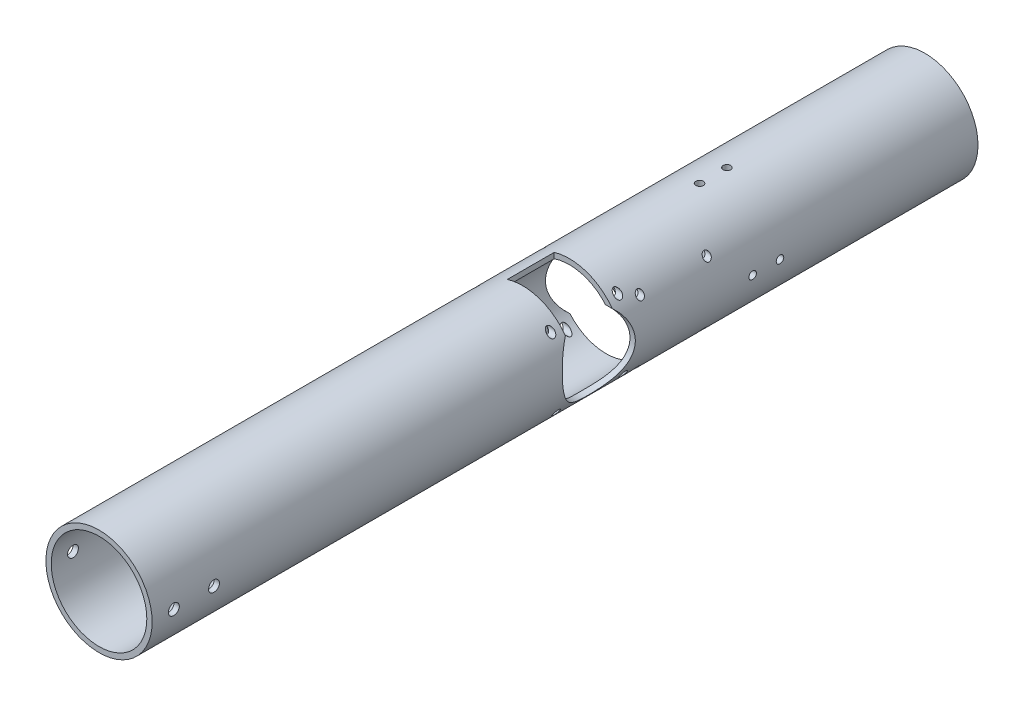
from build123d import *

# Parameters (mm, degrees)
BOSS_EXTRUDE1_DEPTH           = 125
BOSS_EXTRUDE1_DEPTH_BACK      = 250
SKETCH1_R                     = 31.75
SKETCH1_R_2                   = 28.575
SKETCH2_R                     = 21.75
CUT_EXTRUDE1_DEPTH            = 255.000246063
SKETCH3_R                     = 21.75
CUT_EXTRUDE2_DEPTH            = 255.000246187
CUT_EXTRUDE4_START            = 9
SKETCH5_W                     = 28
SKETCH5_H                     = 22
CUT_EXTRUDE4_DEPTH            = 264.000246187
CUT_EXTRUDE5_START            = -9
SKETCH6_W                     = 28
SKETCH6_H                     = 22
CUT_EXTRUDE5_DEPTH            = 264.000246187
CUT_EXTRUDE8_DEPTH            = 255.000246187
CUT_EXTRUDE8_DEPTH_BACK       = 255.000246187
SKETCH11_R                    = 2
CUT_EXTRUDE10_DEPTH           = 255.000246187
CUT_EXTRUDE10_DEPTH_BACK      = 255.000246187
SKETCH12_R                    = 3.25
CUT_EXTRUDE12_DEPTH           = 255.000246187
CUT_EXTRUDE12_DEPTH_BACK      = 255.000246187
SKETCH15_R                    = 2
SKETCH19_W                    = 2.25
SKETCH19_H                    = 31.75
M4_CLEARANCE_HOLE1_AT_2_COUNT = 2
M4_CLEARANCE_HOLE1_AT_2_PITCH = 40
M4_CLEARANCE_HOLE1_AT_3_COUNT = 2
M4_CLEARANCE_HOLE1_AT_3_PITCH = 40
M4_CLEARANCE_HOLE1_AT_4_COUNT = 2
M4_CLEARANCE_HOLE1_AT_4_PITCH = 56.568542495
M4_CLEARANCE_HOLE1_AT_5_COUNT = 2
M4_CLEARANCE_HOLE1_AT_5_PITCH = 90.126807577
M4_CLEARANCE_HOLE1_AT_6_COUNT = 2
M4_CLEARANCE_HOLE1_AT_6_PITCH = 50.197623888
M4_CLEARANCE_HOLE1_AT_7_COUNT = 2
M4_CLEARANCE_HOLE1_AT_7_PITCH = 100.213978286
M4_CLEARANCE_HOLE1_AT_8_COUNT = 2
M4_CLEARANCE_HOLE1_AT_8_PITCH = 66.631835064
MIRROR1_COPY_1_SKETCH_W       = 2.25
MIRROR1_COPY_1_SKETCH_H       = 31.75
MIRROR1_COPY_2_SKETCH_W       = 2.25
MIRROR1_COPY_2_SKETCH_H       = 31.75
MIRROR1_COPY_3_SKETCH_W       = 2.25
MIRROR1_COPY_3_SKETCH_H       = 31.75
MIRROR1_COPY_4_SKETCH_W       = 2.25
MIRROR1_COPY_4_SKETCH_H       = 31.75
MIRROR1_COPY_5_SKETCH_W       = 2.25
MIRROR1_COPY_5_SKETCH_H       = 31.75
MIRROR1_COPY_6_SKETCH_W       = 2.25
MIRROR1_COPY_6_SKETCH_H       = 31.75
MIRROR1_COPY_7_SKETCH_W       = 2.25
MIRROR1_COPY_7_SKETCH_H       = 31.75
SKETCH21_R                    = 30
CUT_EXTRUDE14_DEPTH           = 7
SKETCH22_R                    = 2.25
CUT_EXTRUDE15_DEPTH           = 255.000246187
CIRPATTERN2_COUNT             = 4
SKETCH23_R                    = 30
SKETCH23_R_2                  = 28.575
BOSS_EXTRUDE2_DEPTH           = 7
SKETCH24_R                    = 31.75
SKETCH24_R_2                  = 28.575
BOSS_EXTRUDE3_DEPTH           = 118.65


with BuildPart() as part:
    # Sketch1 → Boss-Extrude1 (new, two sides: drawn at the far end of the back side and taken through both)
    with BuildSketch(Plane.XY.offset(-BOSS_EXTRUDE1_DEPTH_BACK)):
        Circle(SKETCH1_R)
        Circle(SKETCH1_R_2, mode=Mode.SUBTRACT)
    extrude(amount=BOSS_EXTRUDE1_DEPTH + BOSS_EXTRUDE1_DEPTH_BACK)

    # Sketch2 → Cut-Extrude1 (cut, through all)
    with BuildSketch(Plane(origin=(0, 0, 0), x_dir=(0, 0, -1), z_dir=(1, 0, 0))):
        with Locations((73.488, -2)):
            Circle(SKETCH2_R)
    extrude(amount=-CUT_EXTRUDE1_DEPTH, mode=Mode.SUBTRACT)

    # Sketch3 → Cut-Extrude2 (cut, through all)
    with BuildSketch(Plane(origin=(0, 0, 0), x_dir=(0, 0, -1), z_dir=(1, 0, 0))):
        with Locations(Location((23.45, 2, 0), (0, 0, 354.723969399))):
            Circle(SKETCH3_R)
    extrude(amount=CUT_EXTRUDE2_DEPTH, mode=Mode.SUBTRACT)

    # Sketch5 → Cut-Extrude4 (cut, through all)
    with BuildSketch(Plane(origin=(0, 0, 0), x_dir=(0, 0, -1), z_dir=(1, 0, 0)).offset(CUT_EXTRUDE4_START)):
        with Locations((73.488, -23.75)):
            Rectangle(SKETCH5_W, SKETCH5_H)
    extrude(amount=-CUT_EXTRUDE4_DEPTH, mode=Mode.SUBTRACT)

    # Sketch6 → Cut-Extrude5 (cut, through all)
    with BuildSketch(Plane(origin=(0, 0, 0), x_dir=(0, 0, -1), z_dir=(1, 0, 0)).offset(CUT_EXTRUDE5_START)):
        with Locations((23.45, 23.75)):
            Rectangle(SKETCH6_W, SKETCH6_H)
    extrude(amount=CUT_EXTRUDE5_DEPTH, mode=Mode.SUBTRACT)

    # Sketch11 → Cut-Extrude8 (cut, two sides: drawn at the far end of the back side and taken through both)
    with BuildSketch(Plane(origin=(0, 0, 0), x_dir=(0, 0, -1), z_dir=(1, 0, 0)).offset(-CUT_EXTRUDE8_DEPTH_BACK)):
        with Locations((93.488, 18)):
            Circle(SKETCH11_R)
        with Locations((53.488, 18)):
            Circle(SKETCH11_R)
        with Locations((53.488, -22)):
            Circle(SKETCH11_R)
        with Locations((93.488, -22)):
            Circle(SKETCH11_R)
    extrude(amount=CUT_EXTRUDE8_DEPTH + CUT_EXTRUDE8_DEPTH_BACK, mode=Mode.SUBTRACT)

    # Sketch12 → Cut-Extrude10 (cut, two sides: drawn at the far end of the back side and taken through both)
    with BuildSketch(Plane(origin=(0, 0, 0), x_dir=(0, 0, -1), z_dir=(1, 0, 0)).offset(-CUT_EXTRUDE10_DEPTH_BACK)):
        with Locations((-112, 0)):
            Circle(SKETCH12_R)
        with Locations((-88, 0)):
            Circle(SKETCH12_R)
    extrude(amount=CUT_EXTRUDE10_DEPTH + CUT_EXTRUDE10_DEPTH_BACK, mode=Mode.SUBTRACT)

    # Sketch15 → Cut-Extrude12 (cut, two sides: drawn at the far end of the back side and taken through both)
    with BuildSketch(Plane(origin=(0, 0, 0), x_dir=(0, 0, -1), z_dir=(1, 0, 0)).offset(-CUT_EXTRUDE12_DEPTH_BACK)):
        with Locations((3.45, 22)):
            Circle(SKETCH15_R)
        with Locations((43.45, 22)):
            Circle(SKETCH15_R)
        with Locations((43.45, -18)):
            Circle(SKETCH15_R)
        with Locations((3.45, -18)):
            Circle(SKETCH15_R)
    extrude(amount=CUT_EXTRUDE12_DEPTH + CUT_EXTRUDE12_DEPTH_BACK, mode=Mode.SUBTRACT)

    # Sketch19 → M4 Clearance Hole1 (revolve, cut)
    with BuildSketch(Plane(origin=(0, 22, -3.45), x_dir=(0, 0, 1), z_dir=(0, 1, 0))):
        with Locations((1.125, 15.875)):
            Rectangle(SKETCH19_W, SKETCH19_H)
    m4_clearance_hole1 = revolve(axis=Axis((-6.35, 22, -3.45), (1, 0, 0)), mode=Mode.SUBTRACT)

    # M4 Clearance Hole1 at 2: M4 Clearance Hole1 ×2
    with Locations(*[(0, 0, -i * M4_CLEARANCE_HOLE1_AT_2_PITCH) for i in range(1, M4_CLEARANCE_HOLE1_AT_2_COUNT)]):
        add(m4_clearance_hole1, mode=Mode.SUBTRACT)

    # M4 Clearance Hole1 at 3: M4 Clearance Hole1 ×2
    with Locations(*[(0, -i * M4_CLEARANCE_HOLE1_AT_3_PITCH, 0) for i in range(1, M4_CLEARANCE_HOLE1_AT_3_COUNT)]):
        add(m4_clearance_hole1, mode=Mode.SUBTRACT)

    # M4 Clearance Hole1 at 4: M4 Clearance Hole1 ×2
    with Locations(*[Vector(0, -0.7071067811865478, -0.7071067811865472) * (i * M4_CLEARANCE_HOLE1_AT_4_PITCH) for i in range(1, M4_CLEARANCE_HOLE1_AT_4_COUNT)]):
        add(m4_clearance_hole1, mode=Mode.SUBTRACT)

    # M4 Clearance Hole1 at 5: M4 Clearance Hole1 ×2
    with Locations(*[Vector(0, -0.04438191152602306, -0.9990146374950151) * (i * M4_CLEARANCE_HOLE1_AT_5_PITCH) for i in range(1, M4_CLEARANCE_HOLE1_AT_5_COUNT)]):
        add(m4_clearance_hole1, mode=Mode.SUBTRACT)

    # M4 Clearance Hole1 at 6: M4 Clearance Hole1 ×2
    with Locations(*[Vector(0, -0.07968504662542611, -0.9968200907607669) * (i * M4_CLEARANCE_HOLE1_AT_6_PITCH) for i in range(1, M4_CLEARANCE_HOLE1_AT_6_COUNT)]):
        add(m4_clearance_hole1, mode=Mode.SUBTRACT)

    # M4 Clearance Hole1 at 7: M4 Clearance Hole1 ×2
    with Locations(*[Vector(0, -0.43906050585303297, -0.8984574960453493) * (i * M4_CLEARANCE_HOLE1_AT_7_PITCH) for i in range(1, M4_CLEARANCE_HOLE1_AT_7_COUNT)]):
        add(m4_clearance_hole1, mode=Mode.SUBTRACT)

    # M4 Clearance Hole1 at 8: M4 Clearance Hole1 ×2
    with Locations(*[Vector(0, -0.6603450131265124, -0.7509623583369185) * (i * M4_CLEARANCE_HOLE1_AT_8_PITCH) for i in range(1, M4_CLEARANCE_HOLE1_AT_8_COUNT)]):
        add(m4_clearance_hole1, mode=Mode.SUBTRACT)

    # Mirror1: M4 Clearance Hole1 across plane
    add(m4_clearance_hole1.mirror(Plane(origin=(0, 0, 0), x_dir=(0, 0, 1), z_dir=(1, 0, 0))), mode=Mode.SUBTRACT)

    # Mirror1 copy 1 sketch → Mirror1 copy 1 (revolve, cut)
    with BuildSketch(Plane(origin=(0, 22, -43.45), x_dir=(0, 0, 1), z_dir=(0, 1, 0))):
        with Locations((1.125, -15.875)):
            Rectangle(MIRROR1_COPY_1_SKETCH_W, MIRROR1_COPY_1_SKETCH_H)
    revolve(axis=Axis((6.35, 22, -43.45), (1, 0, 0)), mode=Mode.SUBTRACT)

    # Mirror1 copy 2 sketch → Mirror1 copy 2 (revolve, cut)
    with BuildSketch(Plane(origin=(0, -18, -3.45), x_dir=(0, 0, 1), z_dir=(0, 1, 0))):
        with Locations((1.125, -15.875)):
            Rectangle(MIRROR1_COPY_2_SKETCH_W, MIRROR1_COPY_2_SKETCH_H)
    revolve(axis=Axis((6.35, -18, -3.45), (1, 0, 0)), mode=Mode.SUBTRACT)

    # Mirror1 copy 3 sketch → Mirror1 copy 3 (revolve, cut)
    with BuildSketch(Plane(origin=(0, -18, -43.45), x_dir=(0, 0, 1), z_dir=(0, 1, 0))):
        with Locations((1.125, -15.875)):
            Rectangle(MIRROR1_COPY_3_SKETCH_W, MIRROR1_COPY_3_SKETCH_H)
    revolve(axis=Axis((6.35, -18, -43.45), (1, 0, 0)), mode=Mode.SUBTRACT)

    # Mirror1 copy 4 sketch → Mirror1 copy 4 (revolve, cut)
    with BuildSketch(Plane(origin=(0, 18, -93.488), x_dir=(0, 0, 1), z_dir=(0, 1, 0))):
        with Locations((1.125, -15.875)):
            Rectangle(MIRROR1_COPY_4_SKETCH_W, MIRROR1_COPY_4_SKETCH_H)
    revolve(axis=Axis((6.35, 18, -93.488), (1, 0, 0)), mode=Mode.SUBTRACT)

    # Mirror1 copy 5 sketch → Mirror1 copy 5 (revolve, cut)
    with BuildSketch(Plane(origin=(0, 18, -53.488), x_dir=(0, 0, 1), z_dir=(0, 1, 0))):
        with Locations((1.125, -15.875)):
            Rectangle(MIRROR1_COPY_5_SKETCH_W, MIRROR1_COPY_5_SKETCH_H)
    revolve(axis=Axis((6.35, 18, -53.488), (1, 0, 0)), mode=Mode.SUBTRACT)

    # Mirror1 copy 6 sketch → Mirror1 copy 6 (revolve, cut)
    with BuildSketch(Plane(origin=(0, -22, -93.488), x_dir=(0, 0, 1), z_dir=(0, 1, 0))):
        with Locations((1.125, -15.875)):
            Rectangle(MIRROR1_COPY_6_SKETCH_W, MIRROR1_COPY_6_SKETCH_H)
    revolve(axis=Axis((6.35, -22, -93.488), (1, 0, 0)), mode=Mode.SUBTRACT)

    # Mirror1 copy 7 sketch → Mirror1 copy 7 (revolve, cut)
    with BuildSketch(Plane(origin=(0, -22, -53.488), x_dir=(0, 0, 1), z_dir=(0, 1, 0))):
        with Locations((1.125, -15.875)):
            Rectangle(MIRROR1_COPY_7_SKETCH_W, MIRROR1_COPY_7_SKETCH_H)
    revolve(axis=Axis((6.35, -22, -53.488), (1, 0, 0)), mode=Mode.SUBTRACT)

    # Sketch21 → Cut-Extrude14 (cut)
    with BuildSketch(Plane(origin=(0, 0, -250), x_dir=(-1, 0, 0), z_dir=(0, 0, -1))):
        Circle(SKETCH21_R)
    extrude(amount=-CUT_EXTRUDE14_DEPTH, mode=Mode.SUBTRACT)

    # Sketch22 → Cut-Extrude15 (cut, through all)
    with BuildSketch(Plane(origin=(0, 0, 0), x_dir=(0, 0, -1), z_dir=(1, 0, 0))):
        with Locations(Location((131.65, 0, 0), (0, 0, 180))):
            Circle(SKETCH22_R)
        with Locations(Location((115.3, 0, 0), (0, 0, 180))):
            Circle(SKETCH22_R)
    cut_extrude15 = extrude(amount=CUT_EXTRUDE15_DEPTH, mode=Mode.SUBTRACT)

    # CirPattern2: Cut-Extrude15 ×4 about axis
    cirpattern2_axis = Axis((0, 0, -250), (0, 0, 1))
    for i in range(1, CIRPATTERN2_COUNT):
        add(cut_extrude15.rotate(cirpattern2_axis, i * 360 / CIRPATTERN2_COUNT), mode=Mode.SUBTRACT)

    # Sketch23 → Boss-Extrude2 (add)
    with BuildSketch(Plane(origin=(0, 0, -243), x_dir=(-1, 0, 0), z_dir=(0, 0, -1))):
        Circle(SKETCH23_R)
        with Locations(Location((0, 0, 0), (0, 0, 180))):
            Circle(SKETCH23_R_2, mode=Mode.SUBTRACT)
    extrude(amount=BOSS_EXTRUDE2_DEPTH)


with BuildPart() as body_2:
    # Split1: the piece on the far side of the plane
    add(part.part)
    split(bisect_by=Plane.XY.offset(75), keep=Keep.BOTTOM)


with BuildPart() as part_1:
    add(part.part)

    # Split1
    split(bisect_by=Plane.XY.offset(75), keep=Keep.TOP)


with BuildPart() as part_2:
    # Body-Move/Copy1: moved
    add(part_1.part.moved(Location((0, 0, 118.65))))


    add(body_2.part)  # Boss-Extrude3 merges body 2
    # Sketch24 → Boss-Extrude3 (add)
    with BuildSketch(Plane.XY.offset(75)):
        Circle(SKETCH24_R)
        Circle(SKETCH24_R_2, mode=Mode.SUBTRACT)
    extrude(amount=BOSS_EXTRUDE3_DEPTH)


solid = part_2.part
